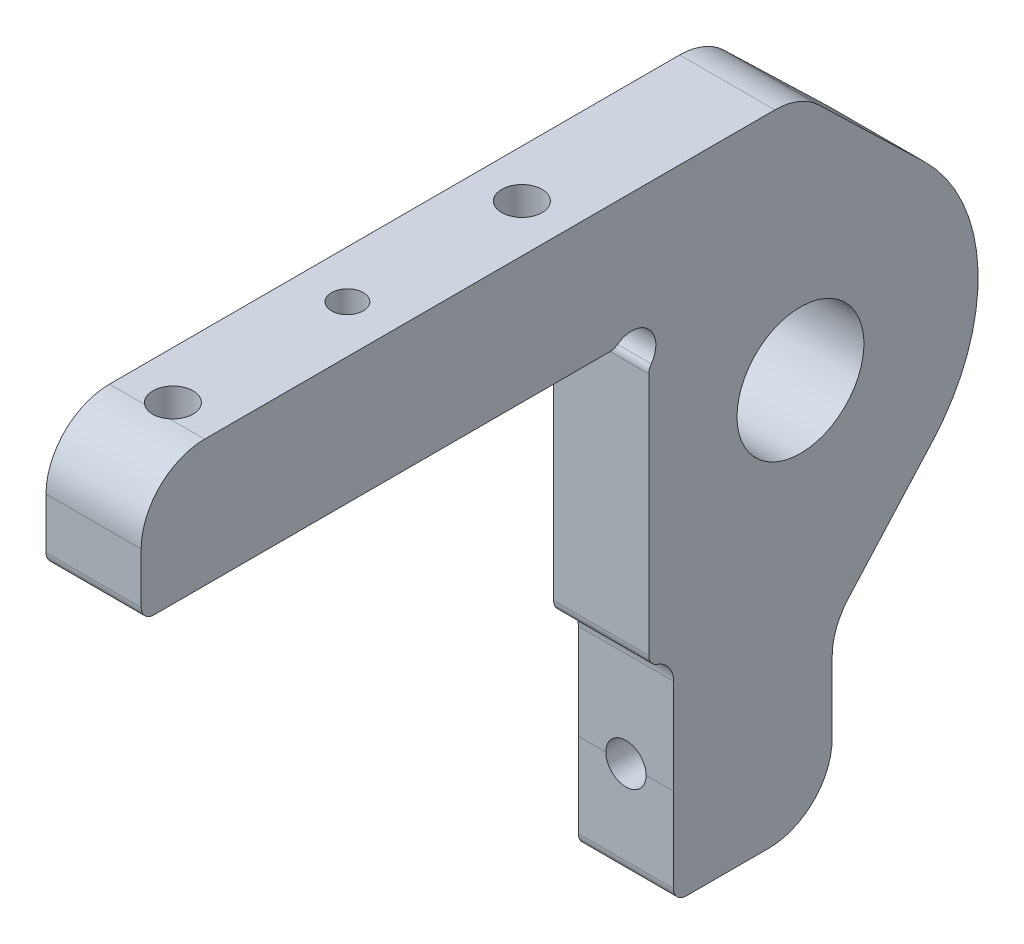
from build123d import *

# Parameters (mm, degrees)
SKETCH1_R              = 6.35
BOSS_EXTRUDE1_DEPTH    = 9.525
SKETCH2_R              = 2.413
CUT_EXTRUDE1_DEPTH     = 133.297838401
F_10_32_TAPPED_HOLE2_D = 4.0386
F_10_32_TAPPED_HOLE3_D = 4.0386
FILLET2_R              = 6.35
FILLET3_R              = 1.27
SKETCH15_R             = 1.5875
DOWEL_PIN_HOLE_DEPTH   = 100.600514289


with BuildPart() as part:
    # Sketch1 → Boss-Extrude1 (new body)
    with BuildSketch(Plane(origin=(0, 0, 0), x_dir=(0, 0, -1), z_dir=(1, 0, 0))):
        with BuildLine():
            Line((-85.0265, 88.20830847), (-85.0265, 100.90830847))
            Line((-85.0265, 100.90830847), (-19.05, 100.90830847))
            Line((-19.05, 100.90830847), (-6.703693037, 88.994416922))
            ThreePointArc((-6.703693037, 88.994416922), (-1.281815332, 76.848084565), (-5.804401761, 64.339033459))
            Line((-5.804401761, 64.339033459), (-15.875, 53.09280847))
            Line((-15.875, 53.09280847), (-15.875, 37.21780847))
            Line((-15.875, 37.21780847), (-31.75, 37.21780847))
            Line((-31.75, 37.21780847), (-31.75, 56.45830847))
            ThreePointArc((-31.75, 56.45830847), (-32.456751337, 58.164557133), (-34.163, 58.87130847))
            Line((-34.163, 58.87130847), (-34.2265, 58.87130847))
            Line((-34.2265, 58.87130847), (-34.2265, 88.20830847))
            Line((-34.2265, 88.20830847), (-85.0265, 88.20830847))
        make_face()
        with Locations(Location((-19.05, 76.2, 0), (0, 0, 180))):
            Circle(SKETCH1_R, mode=Mode.SUBTRACT)
    extrude(amount=BOSS_EXTRUDE1_DEPTH)

    # Sketch2 → Cut-Extrude1 (cut, through all)
    with BuildSketch(Plane(origin=(9.525, 0, 0), x_dir=(0, 0, -1), z_dir=(1, 0, 0))):
        with Locations((-35.932748663, 86.502059807)):
            Circle(SKETCH2_R)
    extrude(amount=-CUT_EXTRUDE1_DEPTH, mode=Mode.SUBTRACT)

    # #10-32 Tapped Hole2 (through all)
    with Locations(Plane(origin=(0, 88.20830847, 0), x_dir=(-1, 0, 0), z_dir=(0, -1, 0))):
        with Locations((-4.7625, -42.164), (-4.7625, -77.089)):
            Hole(F_10_32_TAPPED_HOLE2_D / 2)

    # #10-32 Tapped Hole3 (through all)
    with Locations(Plane.XY.offset(31.75)):
        with Locations((4.7625, 46.93330847)):
            Hole(F_10_32_TAPPED_HOLE3_D / 2)

    # Fillet2
    # the kernel refuses this fillet: 6.35 mm, written as the material it adds along each edge
    with BuildSketch(Plane(origin=(0, 53.09280847, 15.875), x_dir=(0, 0.7449717794882204, -0.6670959809248997), z_dir=(1, 0, 0))) as fillet2_piece_1:
        with BuildLine():
            CenterArc((FILLET2_R * 0.38229614299, -FILLET2_R), FILLET2_R, 90, 41.843324942)
            Line((-FILLET2_R * 0.284799837935, -FILLET2_R * 0.255028220512), (0, 0))
            Line((0, 0), (FILLET2_R * 0.38229614299, 0))
        make_face()
    extrude(amount=9.525)
    # the kernel refuses this fillet: 6.35 mm, written as the material it takes off along each edge
    with BuildSketch(Plane(origin=(-15.875, 100.90830847, 85.0265), x_dir=(0, -1, 0), z_dir=(1, 0, 0))) as fillet2_2_piece_1:
        with BuildLine():
            CenterArc((FILLET2_R, FILLET2_R), FILLET2_R, 180, 90)
            Line((0, FILLET2_R), (0, 0))
            Line((0, 0), (FILLET2_R, 0))
        make_face()
    extrude(amount=41.275, mode=Mode.SUBTRACT)
    with BuildSketch(Plane(origin=(-6.410510576, 100.90830847, 19.05), x_dir=(0, 0, 1), z_dir=(1, 0, 0))) as fillet2_2_piece_2:
        with BuildLine():
            CenterArc((FILLET2_R * 0.403811689842, FILLET2_R), FILLET2_R, 226.021135711, 43.978864289)
            Line((-FILLET2_R * 0.290581277715, FILLET2_R * 0.280403997644), (0, 0))
            Line((0, 0), (FILLET2_R * 0.403811689842, 0))
        make_face()
    extrude(amount=22.346021152, mode=Mode.SUBTRACT)
    with BuildSketch(Plane(origin=(-15.875, 37.21780847, 15.875), x_dir=(0, 0, 1), z_dir=(1, 0, 0))) as fillet2_2_piece_3:
        with BuildLine():
            CenterArc((FILLET2_R, -FILLET2_R), FILLET2_R, 90, 90)
            Line((0, -FILLET2_R), (0, 0))
            Line((0, 0), (FILLET2_R, 0))
        make_face()
    extrude(amount=41.275, mode=Mode.SUBTRACT)

    # Fillet3
    fillet3_edges = [part.edges().sort_by_distance(p)[0] for p in [
        (4.7625, 37.21780847, 31.75),
        (4.7625, 58.87130847, 34.2265),
        (4.7625, 88.20830847, 85.0265),
        (4.7625, 84.795811144, 34.2265),
        (4.7625, 88.20830847, 37.638997326),
    ]]
    fillet(fillet3_edges, radius=FILLET3_R)

    # Sketch15 → Dowel Pin hole (cut, through all)
    with BuildSketch(Plane.XZ.offset(-88.20830847)):
        with Locations(Location((4.7625, 59.6265, 0), (0, 0, 270))):
            Circle(SKETCH15_R)
    extrude(amount=-DOWEL_PIN_HOLE_DEPTH, mode=Mode.SUBTRACT)


solid = part.part
